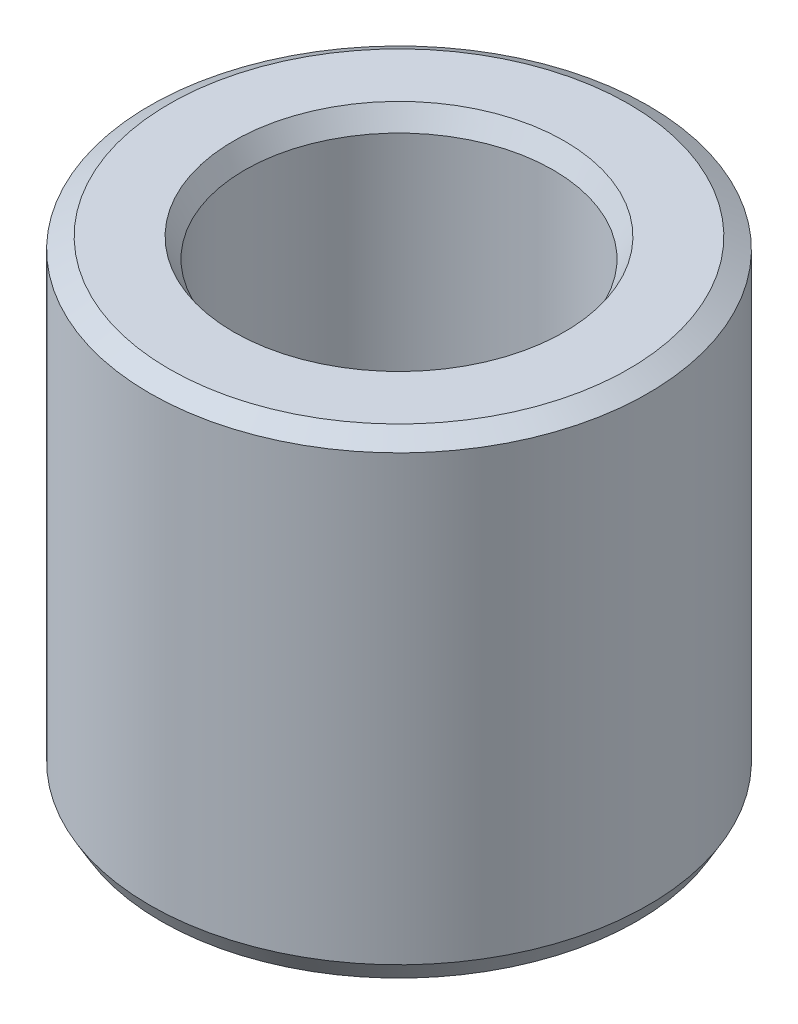
from build123d import *
from OCP.BRepFilletAPI import BRepFilletAPI_MakeChamfer

# Parameters (mm, degrees)
SKETCH1_R           = 32.5
BOSS_EXTRUDE1_DEPTH = 61.824831675
SKETCH2_R           = 20.107463758
CUT_EXTRUDE1_DEPTH  = 78.037716813
CHAMFER1_SIZE       = 1.467030898
CHAMFER1_SIZE2      = 2.540972052


with BuildPart() as part:
    # Sketch1 → Boss-Extrude1 (new body)
    with BuildSketch(Plane(origin=(0, 0, 0), x_dir=(1, 0, 0), z_dir=(0, 1, 0))):
        Circle(SKETCH1_R)
    extrude(amount=BOSS_EXTRUDE1_DEPTH)

    # Sketch2 → Cut-Extrude1 (cut, through all)
    with BuildSketch(Plane(origin=(0, 0, 0), x_dir=(1, 0, 0), z_dir=(0, 1, 0))):
        Circle(SKETCH2_R)
    extrude(amount=CUT_EXTRUDE1_DEPTH, mode=Mode.SUBTRACT)

    # Chamfer1: one chamfer whose edges measure the first distance from different faces: ONE call of the kernel's chamfer builder (chamfer() names one face for all edges)
    chamfer1_edges_1 = [part.edges().sort_by_distance(p)[0] for p in [
        (-20.107463758, 61.824831675, 0),
    ]]
    chamfer1_side_1 = [part.faces().sort_by_distance(p)[0] for p in [
        (-31.580761184, 61.824831675, 0),
    ]]
    chamfer1_edges_2 = [part.edges().sort_by_distance(p)[0] for p in [
        (-20.107463758, 0, 0),
    ]]
    chamfer1_side_2 = [part.faces().sort_by_distance(p)[0] for p in [
        (-20.107463758, 30.912415838, 0),
    ]]
    chamfer1_edges_3 = [part.edges().sort_by_distance(p)[0] for p in [
        (-32.5, 0, 0),
    ]]
    chamfer1_side_3 = [part.faces().sort_by_distance(p)[0] for p in [
        (-31.580761184, 0, 0),
    ]]
    chamfer1_edges_4 = [part.edges().sort_by_distance(p)[0] for p in [
        (-32.5, 61.824831675, 0),
    ]]
    chamfer1_side_4 = [part.faces().sort_by_distance(p)[0] for p in [
        (-32.5, 30.912415838, 0),
    ]]
    chamfer1 = BRepFilletAPI_MakeChamfer(part.part.solid().wrapped)
    for e in chamfer1_edges_1:
        chamfer1.Add(CHAMFER1_SIZE, CHAMFER1_SIZE2, e.wrapped, chamfer1_side_1[0].wrapped)  # the first distance lies on this face
    for e in chamfer1_edges_2:
        chamfer1.Add(CHAMFER1_SIZE, CHAMFER1_SIZE2, e.wrapped, chamfer1_side_2[0].wrapped)  # the first distance lies on this face
    for e in chamfer1_edges_3:
        chamfer1.Add(CHAMFER1_SIZE, CHAMFER1_SIZE2, e.wrapped, chamfer1_side_3[0].wrapped)  # the first distance lies on this face
    for e in chamfer1_edges_4:
        chamfer1.Add(CHAMFER1_SIZE, CHAMFER1_SIZE2, e.wrapped, chamfer1_side_4[0].wrapped)  # the first distance lies on this face
    add(Compound.cast(chamfer1.Shape()), mode=Mode.REPLACE)


solid = part.part
